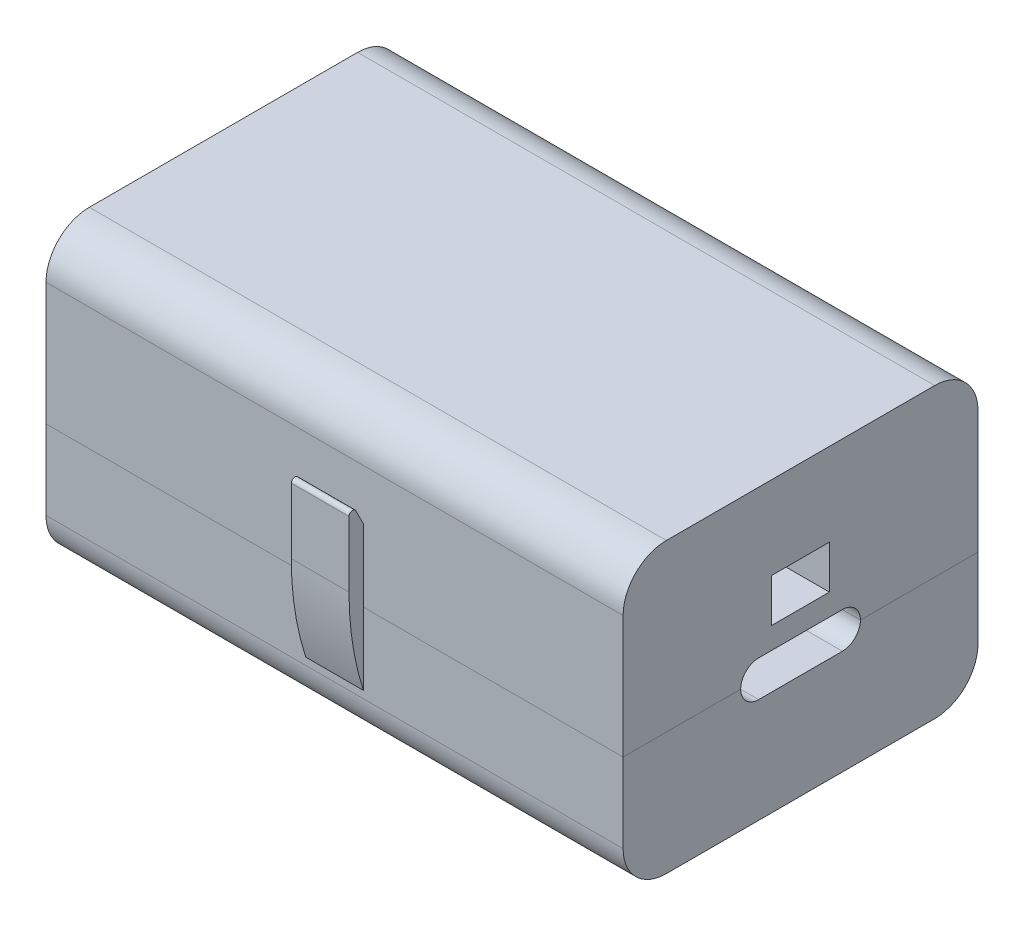
from build123d import *

# Parameters (mm, degrees)
SKETCH1_W            = 40
SKETCH1_H            = 24.6
SKETCH1_W_2          = 34
SKETCH1_H_2          = 18.6
BOSS_EXTRUDE1_DEPTH  = 14
CUT_EXTRUDE1_DEPTH   = 10
SKETCH5_W            = 4
SKETCH5_H            = 3
CUT_EXTRUDE2_DEPTH   = 10
BOSS_EXTRUDE2_DEPTH  = 40
BOSS_EXTRUDE3_DEPTH  = 40
SKETCH8_W            = 4
SKETCH8_H            = 12
BOSS_EXTRUDE4_DEPTH  = 1
FILLET4_R            = 21
SKETCH10_W           = 4
SKETCH10_H           = 2
BOSS_EXTRUDE6_DEPTH  = 1
SKETCH13_W           = 2
SKETCH13_H           = 3
BOSS_EXTRUDE7_DEPTH  = 1
SKETCH14_W           = 2
SKETCH14_H           = 1.5
BOSS_EXTRUDE9_DEPTH  = 1
SKETCH14_4_W         = 2
SKETCH14_4_H         = 1.5
BOSS_EXTRUDE10_DEPTH = 1
CUT_EXTRUDE5_DEPTH   = 28
CUT_EXTRUDE6_DEPTH   = 28
FILLET7_R            = 0.25
SKETCH18_W           = 34
SKETCH18_H           = 18.6
BOSS_EXTRUDE11_DEPTH = 1.25
CUT_EXTRUDE7_DEPTH   = 5.25


with BuildPart() as part:
    # Sketch1 → Boss-Extrude1 (new body)
    with BuildSketch(Plane(origin=(0, 0, 0), x_dir=(1, 0, 0), z_dir=(0, 1, 0))):
        Rectangle(SKETCH1_W, SKETCH1_H)
        Rectangle(SKETCH1_W_2, SKETCH1_H_2, mode=Mode.SUBTRACT)
    extrude(amount=BOSS_EXTRUDE1_DEPTH)

    # Sketch3 → Cut-Extrude1 (cut)
    with BuildSketch(Plane(origin=(20, 0, 0), x_dir=(0, 0, -1), z_dir=(1, 0, 0))):
        with BuildLine():
            ThreePointArc((2.9, 4.25), (4.15, 5.5), (2.9, 6.75))
            Line((2.9, 6.75), (-2.9, 6.75))
            ThreePointArc((-2.9, 6.75), (-4.15, 5.5), (-2.9, 4.25))
            Line((-2.9, 4.25), (2.9, 4.25))
        make_face()
    extrude(amount=-CUT_EXTRUDE1_DEPTH, mode=Mode.SUBTRACT)


with BuildPart() as body_2:
    # Split1: the piece on the far side of the plane
    add(part.part)
    split(bisect_by=Plane(origin=(0, 5.5, 0), x_dir=(0, 0, -1), z_dir=(0, -1, 0)), keep=Keep.BOTTOM)

    # Sketch5 → Cut-Extrude2 (cut)
    with BuildSketch(Plane(origin=(20, 0, 0), x_dir=(0, 0, -1), z_dir=(1, 0, 0))):
        with Locations((0, 9.75)):
            Rectangle(SKETCH5_W, SKETCH5_H)
    extrude(amount=-CUT_EXTRUDE2_DEPTH, mode=Mode.SUBTRACT)

    # Sketch6 → Boss-Extrude2 (add)
    with BuildSketch(Plane(origin=(20, 0, 0), x_dir=(0, 0, -1), z_dir=(1, 0, 0))):
        with BuildLine():
            Line((-9.3, 17), (9.3, 17))
            ThreePointArc((9.3, 17), (11.421320344, 16.121320344), (12.3, 14))
            Line((12.3, 14), (-12.3, 14))
            ThreePointArc((-12.3, 14), (-11.421320344, 16.121320344), (-9.3, 17))
        make_face()
    extrude(amount=-BOSS_EXTRUDE2_DEPTH)


with BuildPart() as part_1:
    add(part.part)

    # Split1
    split(bisect_by=Plane(origin=(0, 5.5, 0), x_dir=(0, 0, -1), z_dir=(0, -1, 0)), keep=Keep.TOP)

    # Sketch7 → Boss-Extrude3 (add)
    with BuildSketch(Plane.ZY.offset(20)):
        with BuildLine():
            Line((-9.3, -3), (9.3, -3))
            ThreePointArc((9.3, -3), (11.421320344, -2.121320344), (12.3, 0))
            Line((12.3, 0), (-12.3, 0))
            ThreePointArc((-12.3, 0), (-11.421320344, -2.121320344), (-9.3, -3))
        make_face()
    extrude(amount=-BOSS_EXTRUDE3_DEPTH)

    # Sketch8 → Boss-Extrude4 (add)
    with BuildSketch(Plane.XY.offset(12.3)):
        with Locations((0, 6.5)):
            Rectangle(SKETCH8_W, SKETCH8_H)
    extrude(amount=BOSS_EXTRUDE4_DEPTH)

    # Fillet4
    # the kernel refuses this fillet: 21 mm, written as the material it takes off along each edge
    with BuildSketch(Plane(origin=(18.007810594, 0.5, 13.3), x_dir=(0, 0, -1), z_dir=(-1, 0, 0))) as fillet4_piece_1:
        with BuildLine():
            CenterArc((21, -6.403124237), FILLET4_R, 162.247209838, 17.752790162)
            Line((0, -6.403124237), (-0.42, -6.403124237))
            Line((-0.42, -6.403124237), (-0.42, 0))
            Line((-0.42, 0), (0, 0.42))
            ThreePointArc((0, 0.42), (0.5, 0.42), (0.6, 0.128062485))
            Line((0.6, 0.128062485), (1, 0))
        make_face()
    extrude(amount=36.015621187, mode=Mode.SUBTRACT)

    # Sketch10 → Boss-Extrude6 (add)
    with BuildSketch(Plane(origin=(0, 0, 12.3), x_dir=(-1, 0, 0), z_dir=(0, 0, -1))):
        with Locations((0, 9.5)):
            Rectangle(SKETCH10_W, SKETCH10_H)
    extrude(amount=BOSS_EXTRUDE6_DEPTH)

    # Sketch13 → Boss-Extrude7 (add)
    with BuildSketch(Plane(origin=(0, 0, -12.3), x_dir=(-1, 0, 0), z_dir=(0, 0, -1))):
        with Locations((-12, 7)):
            Rectangle(SKETCH13_W, SKETCH13_H)
        with Locations((12, 7)):
            Rectangle(SKETCH13_W, SKETCH13_H)
    extrude(amount=-BOSS_EXTRUDE7_DEPTH)

    # Sketch14 → Boss-Extrude9 (add)
    with BuildSketch(Plane.XY.offset(-11.3)):
        with Locations((12, 7.75)):
            Rectangle(SKETCH14_W, SKETCH14_H)
    extrude(amount=BOSS_EXTRUDE9_DEPTH)

    # Sketch14<4> → Boss-Extrude10 (add)
    with BuildSketch(Plane.XY.offset(-11.3)):
        with Locations((-12, 7.75)):
            Rectangle(SKETCH14_4_W, SKETCH14_4_H)
        with Locations((12, 7.75)):
            Rectangle(SKETCH14_4_W, SKETCH14_4_H)
    extrude(amount=BOSS_EXTRUDE10_DEPTH)

    # Sketch15 → Cut-Extrude5 (cut)
    with BuildSketch(Plane(origin=(13, 0, 0), x_dir=(0, 0, -1), z_dir=(1, 0, 0))):
        Polygon((10.3, 7), (11.3, 8.5), (10.3, 8.5), align=None)
    extrude(amount=-CUT_EXTRUDE5_DEPTH, mode=Mode.SUBTRACT)

    # Sketch16 → Cut-Extrude6 (cut)
    with BuildSketch(Plane(origin=(2, 0, 0), x_dir=(0, 0, -1), z_dir=(1, 0, 0))):
        Polygon((-13.3, 12.5), (-12.3, 10.5), (-12.3, 12.5), align=None)
    extrude(amount=-CUT_EXTRUDE6_DEPTH, mode=Mode.SUBTRACT)

    # Fillet7
    fillet7_edges = [part_1.edges().sort_by_distance(p)[0] for p in [
        (0, 12.5, 13.3),
    ]]
    fillet(fillet7_edges, radius=FILLET7_R)

    # Sketch18 → Boss-Extrude11 (add)
    with BuildSketch(Plane(origin=(0, 0, 0), x_dir=(1, 0, 0), z_dir=(0, 1, 0))):
        Rectangle(SKETCH18_W, SKETCH18_H)
    extrude(amount=BOSS_EXTRUDE11_DEPTH)

    # Sketch19 → Cut-Extrude7 (cut)
    with BuildSketch(Plane.ZY.offset(2)):
        Polygon((12.3, 10.5), (11.3, 8.5), (11.3, 10.5), align=None)
    extrude(amount=-CUT_EXTRUDE7_DEPTH, mode=Mode.SUBTRACT)


solid = Compound([body_2.part, part_1.part])
